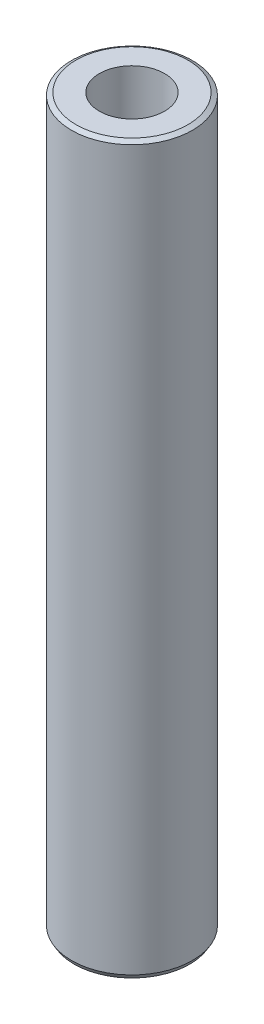
from build123d import *
from OCP.BRepFilletAPI import BRepFilletAPI_MakeChamfer

# Parameters (mm, degrees)
SKETCH1_R           = 12.5
BOSS_EXTRUDE1_DEPTH = 150.049705703
SKETCH2_R           = 6.74713229
CUT_EXTRUDE1_DEPTH  = 152.087438861
CHAMFER1_SIZE       = 0.537799319
CHAMFER1_SIZE2      = 0.931495744


with BuildPart() as part:
    # Sketch1 → Boss-Extrude1 (new body)
    with BuildSketch(Plane(origin=(0, 0, 0), x_dir=(1, 0, 0), z_dir=(0, 1, 0))):
        Circle(SKETCH1_R)
    extrude(amount=BOSS_EXTRUDE1_DEPTH)

    # Sketch2 → Cut-Extrude1 (cut, through all)
    with BuildSketch(Plane(origin=(0, 0, 0), x_dir=(1, 0, 0), z_dir=(0, 1, 0))):
        Circle(SKETCH2_R)
    extrude(amount=CUT_EXTRUDE1_DEPTH, mode=Mode.SUBTRACT)

    # Chamfer1: one chamfer whose edges measure the first distance from different faces: ONE call of the kernel's chamfer builder (chamfer() names one face for all edges)
    chamfer1_edges_1 = [part.edges().sort_by_distance(p)[0] for p in [
        (-12.5, 150.049705703, 0),
    ]]
    chamfer1_side_1 = [part.faces().sort_by_distance(p)[0] for p in [
        (-12.5, 75.024852852, 0),
    ]]
    chamfer1_edges_2 = [part.edges().sort_by_distance(p)[0] for p in [
        (-12.5, 0, 0),
    ]]
    chamfer1_side_2 = [part.faces().sort_by_distance(p)[0] for p in [
        (-12.146446609, 0, 0),
    ]]
    chamfer1 = BRepFilletAPI_MakeChamfer(part.part.solid().wrapped)
    for e in chamfer1_edges_1:
        chamfer1.Add(CHAMFER1_SIZE, CHAMFER1_SIZE2, e.wrapped, chamfer1_side_1[0].wrapped)  # the first distance lies on this face
    for e in chamfer1_edges_2:
        chamfer1.Add(CHAMFER1_SIZE, CHAMFER1_SIZE2, e.wrapped, chamfer1_side_2[0].wrapped)  # the first distance lies on this face
    add(Compound.cast(chamfer1.Shape()), mode=Mode.REPLACE)


solid = part.part
